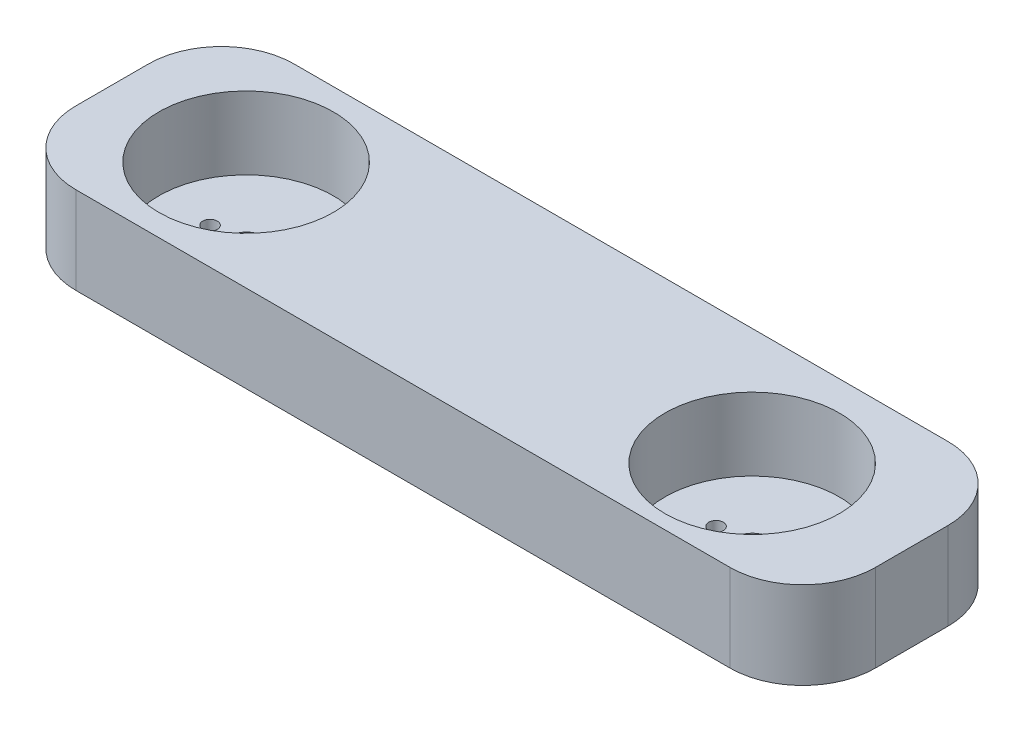
from build123d import *

# Parameters (mm, degrees)
SKETCH1_W           = 110
SKETCH1_H           = 30
BOSS_EXTRUDE1_DEPTH = 12
FILLET1_R           = 10
FILLET2_R           = 10
SKETCH9_R           = 12
CUT_EXTRUDE5_DEPTH  = 10
SKETCH10_R          = 2.4
SKETCH10_R_2        = 1
CUT_EXTRUDE6_DEPTH  = 64.95366743
SKETCH13_R          = 12
CUT_EXTRUDE7_DEPTH  = 10
SKETCH15_R          = 2.4
SKETCH15_R_2        = 1
CUT_EXTRUDE8_DEPTH  = 123.308661002


with BuildPart() as part:
    # Sketch1 → Boss-Extrude1 (new body)
    with BuildSketch(Plane(origin=(0, 0, 0), x_dir=(1, 0, 0), z_dir=(0, 1, 0))):
        with Locations((5.385430756, 3.53837453)):
            Rectangle(SKETCH1_W, SKETCH1_H)
    extrude(amount=BOSS_EXTRUDE1_DEPTH)

    # Fillet1
    fillet1_edges = [part.edges().sort_by_distance(p)[0] for p in [
        (-49.614569244, 6, -18.53837453),
        (-49.614569244, 6, 11.46162547),
    ]]
    fillet(fillet1_edges, radius=FILLET1_R)

    # Fillet2
    fillet2_edges = [part.edges().sort_by_distance(p)[0] for p in [
        (60.385430756, 6, -18.53837453),
        (60.385430756, 6, 11.46162547),
    ]]
    fillet(fillet2_edges, radius=FILLET2_R)

    # Sketch9 → Cut-Extrude5 (cut)
    with BuildSketch(Plane(origin=(0, 12, 0), x_dir=(1, 0, 0), z_dir=(0, 1, 0))):
        with Locations((-31.195762423, 3.53837453)):
            Circle(SKETCH9_R)
    extrude(amount=-CUT_EXTRUDE5_DEPTH, mode=Mode.SUBTRACT)

    # Sketch10 → Cut-Extrude6 (cut, through all)
    with BuildSketch(Plane(origin=(0, 2, 0), x_dir=(1, 0, 0), z_dir=(0, 1, 0))):
        with Locations((-31.147671482, 3.53837453)):
            Circle(SKETCH10_R)
        with Locations((-26.131792826, 3.53837453)):
            Circle(SKETCH10_R_2)
        with Locations((-36.163550137, 3.53837453)):
            Circle(SKETCH10_R_2)
    extrude(amount=-CUT_EXTRUDE6_DEPTH, mode=Mode.SUBTRACT)

    # Sketch13 → Cut-Extrude7 (cut)
    with BuildSketch(Plane(origin=(70.696833098, 12, 1.072209922), x_dir=(1, 0, 0), z_dir=(0, 1, 0))):
        with Locations((-31.195762423, 3.53837453)):
            Circle(SKETCH13_R)
    extrude(amount=-CUT_EXTRUDE7_DEPTH, mode=Mode.SUBTRACT)

    # Sketch15 → Cut-Extrude8 (cut, through all)
    with BuildSketch(Plane(origin=(70.696833098, 2, 1.072209922), x_dir=(1, 0, 0), z_dir=(0, 1, 0))):
        with Locations((-31.147671482, 3.53837453)):
            Circle(SKETCH15_R)
        with Locations((-26.131792826, 3.53837453)):
            Circle(SKETCH15_R_2)
        with Locations((-36.163550137, 3.53837453)):
            Circle(SKETCH15_R_2)
    extrude(amount=-CUT_EXTRUDE8_DEPTH, mode=Mode.SUBTRACT)


solid = part.part
